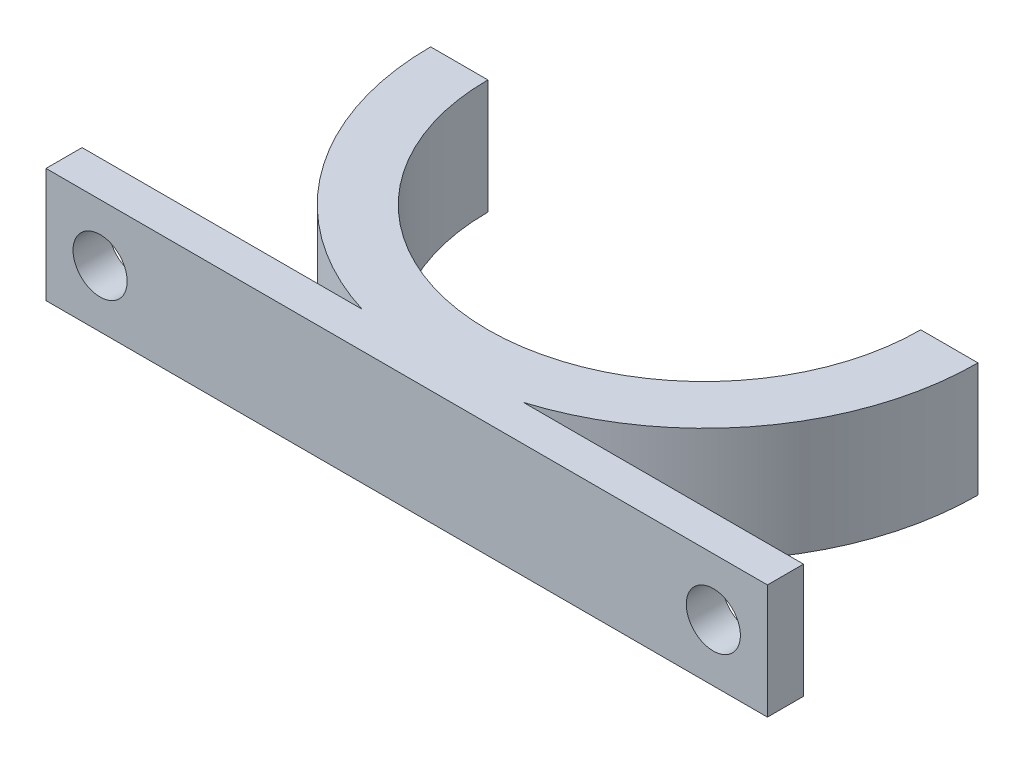
from build123d import *

# Parameters (mm, degrees)
BOSS_EXTRUDE1_DEPTH = 6.35
SKETCH2_R           = 1.5
CUT_EXTRUDE1_DEPTH  = 6.35


with BuildPart() as part:
    # Sketch1 → Boss-Extrude1 (new body)
    with BuildSketch(Plane(origin=(0, 0, 0), x_dir=(1, 0, 0), z_dir=(0, 1, 0))):
        with BuildLine():
            Line((0, 0), (20, 0))
            Line((20, 0), (20, 2))
            Line((20, 2), (4.475558624, 2))
            ThreePointArc((4.475558624, 2), (12.210594317, 7.489893927), (15.175, 16.5))
            Line((15.175, 16.5), (12, 16.5))
            ThreePointArc((12, 16.5), (0, 4.5), (-12, 16.5))
            Line((-12, 16.5), (-15.175, 16.5))
            ThreePointArc((-15.175, 16.5), (-12.210594317, 7.489893927), (-4.475558624, 2))
            Line((-4.475558624, 2), (-20, 2))
            Line((-20, 2), (-20, 0))
            Line((-20, 0), (0, 0))
        make_face()
    extrude(amount=BOSS_EXTRUDE1_DEPTH)

    # Sketch2 → Cut-Extrude1 (cut)
    with BuildSketch(Plane(origin=(0, 0, -2), x_dir=(-1, 0, 0), z_dir=(0, 0, -1))):
        with Locations((-17, 3.175)):
            Circle(SKETCH2_R)
        with Locations((17, 3.175)):
            Circle(SKETCH2_R)
    extrude(amount=-CUT_EXTRUDE1_DEPTH, mode=Mode.SUBTRACT)


solid = part.part
